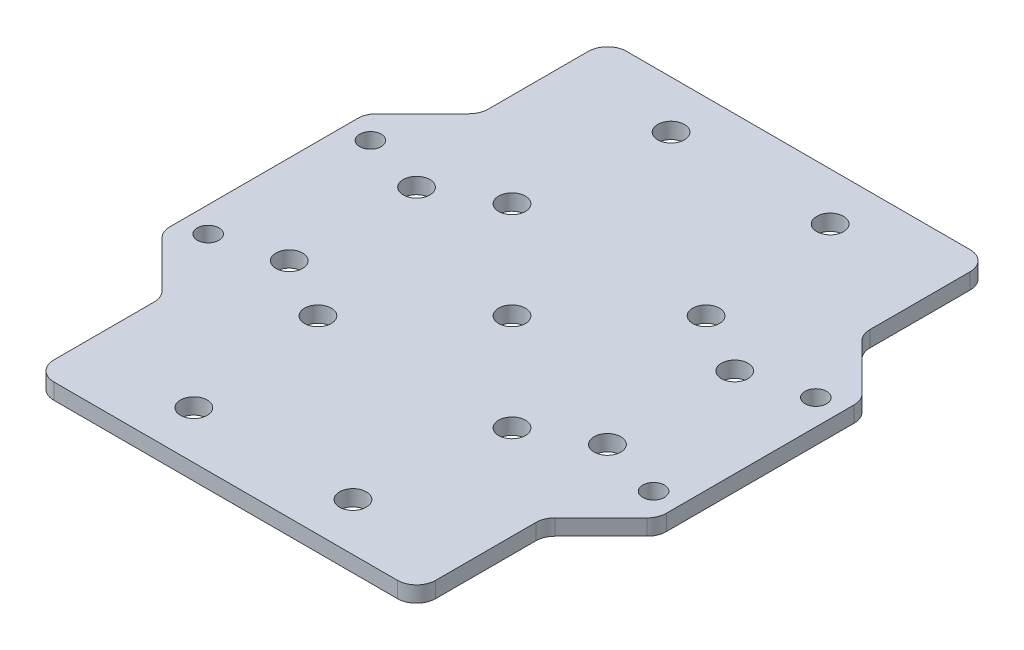
from build123d import *

# Parameters (mm, degrees)
BOSS_EXTRUDE1_DEPTH        = 1.25
FILLET1_R                  = 3
F_4_2_4_2_DIAMETER_HOLE1_D = 4.2
M3_CLEARANCE_HOLE1_D       = 3.4
F_4_2_4_2_DIAMETER_HOLE2_D = 4.2


with BuildPart() as part:
    # Sketch1 → Boss-Extrude1 (new, symmetric)
    with BuildSketch(Plane(origin=(0, 0, 0), x_dir=(1, 0, 0), z_dir=(0, 1, 0))):
        Polygon((30, 45), (-30, 45), (-30, 25), (-39, 16), (-39, -16), (-30, -25), (-30, -45), (30, -45), (30, -25), (39, -16), (39, 16), (30, 25), align=None)
    extrude(amount=BOSS_EXTRUDE1_DEPTH, both=True)

    # Fillet1
    fillet1_edges = [part.edges().sort_by_distance(p)[0] for p in [
        (30, 0, -45),
        (30, 0, 45),
        (-30, 0, 45),
        (-30, 0, -45),
        (30, 0, 25),
        (39, 0, 16),
        (39, 0, -16),
        (30, 0, -25),
        (-39, 0, -16),
        (-30, 0, -25),
        (-39, 0, 16),
        (-30, 0, 25),
    ]]
    fillet(fillet1_edges, radius=FILLET1_R)

    # Ø4.2 (4.2) Diameter Hole1 (through all)
    with Locations(Plane(origin=(0, 1.25, 0), x_dir=(1, 0, 0), z_dir=(0, 1, 0))):
        with Locations((0, 0), (15.25, -15.25), (-15.25, 15.25), (-15.25, -15.25), (15.25, 15.25)):
            Hole(F_4_2_4_2_DIAMETER_HOLE1_D / 2)

    # M3 Clearance Hole1 (through all)
    with Locations(Plane(origin=(0, 1.25, 0), x_dir=(1, 0, 0), z_dir=(0, 1, 0))):
        with Locations((35, 12.75), (35, -12.75), (-35, -12.75), (-35, 12.75)):
            Hole(M3_CLEARANCE_HOLE1_D / 2)

    # Ø4.2 (4.2) Diameter Hole2 (through all)
    with Locations(Plane(origin=(0, -1.25, 0), x_dir=(-1, 0, 0), z_dir=(0, -1, 0))):
        with Locations((-12.5, 37.5), (-25, 10), (-25, -10), (-12.5, -37.5), (12.5, -37.5), (25, -10), (12.5, 37.5), (25, 10)):
            Hole(F_4_2_4_2_DIAMETER_HOLE2_D / 2)


solid = part.part
